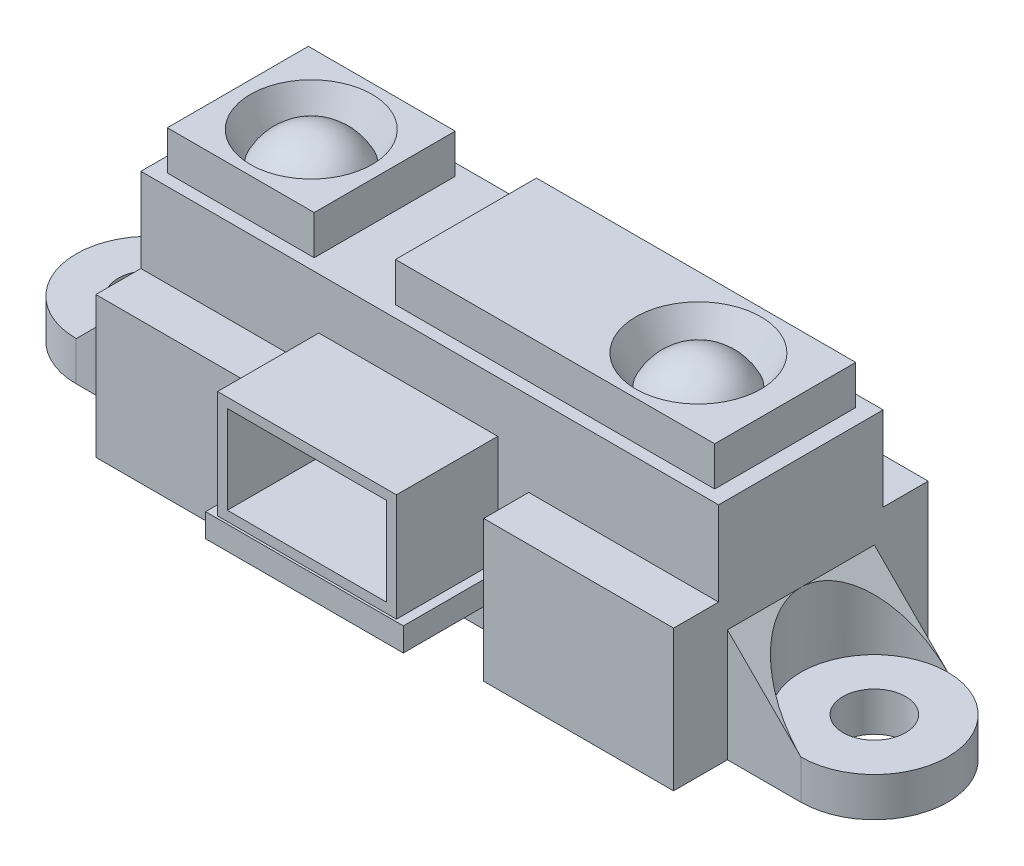
from build123d import *

# Parameters (mm, degrees)
BOSS_EXTRUDE1_DEPTH   = 7.2
SKETCH1_3_R           = 3.75
SKETCH1_3_R_2         = 1.6
BOSS_EXTRUDE2_DEPTH   = 2
BOSS_EXTRUDE2_2_DEPTH = 2
BOSS_EXTRUDE3_DEPTH   = 2
BOSS_EXTRUDE4_DEPTH   = 7.5
SKETCH3_R             = 3.75
CUT_EXTRUDE6_DEPTH    = 12
BOSS_EXTRUDE5_DEPTH   = 7.5
SKETCH5_R             = 3.75
CUT_EXTRUDE7_DEPTH    = 7.5
SKETCH6_W             = 29.5
SKETCH6_H             = 8.4
BOSS_EXTRUDE6_DEPTH   = 4.3
SKETCH7_W             = 7.5
SKETCH7_H             = 7.2
SKETCH7_W_2           = 16.3
BOSS_EXTRUDE7_DEPTH   = 2
SKETCH8_W             = 10.1
SKETCH8_H             = 2.3
CUT_EXTRUDE8_DEPTH    = 12
SKETCH9_W             = 10.1
SKETCH9_H             = 1.2
BOSS_EXTRUDE8_DEPTH   = 6.4
SKETCH11_W            = 9.1347476
SKETCH11_H            = 5.173710516
BOSS_EXTRUDE11_DEPTH  = 5.5
SKETCH12_R            = 3.106234899
CUT_EXTRUDE10_DEPTH   = 1.5
CUT_EXTRUDE10_DRAFT   = -25
SKETCH13_R            = 3.196774454
CUT_EXTRUDE11_DEPTH   = 1.5
CUT_EXTRUDE11_DRAFT   = -29
SKETCH14_W            = 8.1347476
SKETCH14_H            = 4.5
CUT_EXTRUDE12_DEPTH   = 4.5
SCALE1_SCALE          = 0.2


# Read off the part's stored shape, not the designer's step: Dome1, Dome2
with BuildPart() as part:
    # Sketch1 → Boss-Extrude1 (new body)
    with BuildSketch(Plane(origin=(0, 0, 0), x_dir=(1, 0, 0), z_dir=(0, 1, 0))):
        Polygon((14.75, 0), (-14.75, 0), (-14.75, -3.75), (-14.75, -6.5), (14.75, -6.5), (14.75, -3.75), align=None)
        Polygon((-14.75, 3.75), (-14.75, 0), (14.75, 0), (14.75, 3.75), (14.75, 6.5), (-14.75, 6.5), align=None)
    extrude(amount=BOSS_EXTRUDE1_DEPTH)



with BuildPart() as body_2:
    # Sketch1<3> → Boss-Extrude2 (new body)
    with BuildSketch(Plane(origin=(0, 0, 0), x_dir=(1, 0, 0), z_dir=(0, 1, 0))):
        with Locations(Location((-18.5, 0, 0), (0, 0, 270))):
            Circle(SKETCH1_3_R)
        with Locations(Location((-18.5, 0, 0), (0, 0, 270))):
            Circle(SKETCH1_3_R_2, mode=Mode.SUBTRACT)
    extrude(amount=BOSS_EXTRUDE2_DEPTH)


with BuildPart() as body_3:
    # Sketch1<3> → Boss-Extrude2 2 (new body)
    with BuildSketch(Plane(origin=(0, 0, 0), x_dir=(1, 0, 0), z_dir=(0, 1, 0))):
        with Locations(Location((18.5, 0, 0), (0, 0, 270))):
            Circle(SKETCH1_3_R)
        with Locations(Location((18.5, 0, 0), (0, 0, 270))):
            Circle(SKETCH1_3_R_2, mode=Mode.SUBTRACT)
    extrude(amount=BOSS_EXTRUDE2_2_DEPTH)


with BuildPart() as part_1:
    add(part.part)

    add(body_2.part)  # Boss-Extrude3 merges body 2

    add(body_3.part)  # Boss-Extrude3 merges body 3
    # Sketch1<4> → Boss-Extrude3 (add)
    with BuildSketch(Plane(origin=(0, 0, 0), x_dir=(1, 0, 0), z_dir=(0, 1, 0))):
        with BuildLine():
            Line((-14.75, -3.75), (-14.75, 0))
            ThreePointArc((-14.75, 0), (-15.848349571, -2.651650429), (-18.5, -3.75))
            Line((-18.5, -3.75), (-14.75, -3.75))
        make_face()
        with BuildLine():
            Line((-14.75, 0), (-14.75, 3.75))
            Line((-14.75, 3.75), (-18.5, 3.75))
            ThreePointArc((-18.5, 3.75), (-15.848349571, 2.651650429), (-14.75, 0))
        make_face()
        with BuildLine():
            Line((18.5, 3.75), (14.75, 3.75))
            Line((14.75, 3.75), (14.75, 0))
            ThreePointArc((14.75, 0), (15.848349571, 2.651650429), (18.5, 3.75))
        make_face()
        with BuildLine():
            ThreePointArc((18.5, -3.75), (15.848349571, -2.651650429), (14.75, 0))
            Line((14.75, 0), (14.75, -3.75))
            Line((14.75, -3.75), (18.5, -3.75))
        make_face()
    extrude(amount=BOSS_EXTRUDE3_DEPTH)

    # Sketch2 → Boss-Extrude4 (add)
    with BuildSketch(Plane.XY.offset(3.75)):
        Polygon((18.5, 2), (14.75, 2), (14.75, 5.75), align=None)
    extrude(amount=-BOSS_EXTRUDE4_DEPTH)

    # Sketch3 → Cut-Extrude6 (cut)
    with BuildSketch(Plane(origin=(0, 2, 0), x_dir=(1, 0, 0), z_dir=(0, 1, 0))):
        with Locations((18.5, 0)):
            Circle(SKETCH3_R)
    extrude(amount=CUT_EXTRUDE6_DEPTH, mode=Mode.SUBTRACT)

    # Sketch4 → Boss-Extrude5 (add)
    with BuildSketch(Plane.XY.offset(3.75)):
        Polygon((-14.75, 5.75), (-18.5, 2), (-14.75, 2), align=None)
    extrude(amount=-BOSS_EXTRUDE5_DEPTH)

    # Sketch5 → Cut-Extrude7 (cut)
    with BuildSketch(Plane(origin=(0, 2, 0), x_dir=(1, 0, 0), z_dir=(0, 1, 0))):
        with Locations((-18.5, 0)):
            Circle(SKETCH5_R)
    extrude(amount=CUT_EXTRUDE7_DEPTH, mode=Mode.SUBTRACT)

    # Sketch6 → Boss-Extrude6 (add)
    with BuildSketch(Plane(origin=(0, 7.2, 0), x_dir=(1, 0, 0), z_dir=(0, 1, 0))):
        Rectangle(SKETCH6_W, SKETCH6_H)
    extrude(amount=BOSS_EXTRUDE6_DEPTH)

    # Sketch7 → Boss-Extrude7 (add)
    with BuildSketch(Plane(origin=(0, 11.5, 0), x_dir=(1, 0, 0), z_dir=(0, 1, 0))):
        with Locations((-10.25, 0)):
            Rectangle(SKETCH7_W, SKETCH7_H)
        with Locations((5.8, 0)):
            Rectangle(SKETCH7_W_2, SKETCH7_H)
    extrude(amount=BOSS_EXTRUDE7_DEPTH)

    # Sketch8 → Cut-Extrude8 (cut)
    with BuildSketch(Plane(origin=(0, 7.2, 0), x_dir=(1, 0, 0), z_dir=(0, 1, 0))):
        with Locations((0.003829246, -5.35)):
            Rectangle(SKETCH8_W, SKETCH8_H)
    extrude(amount=-CUT_EXTRUDE8_DEPTH, mode=Mode.SUBTRACT)

    # Sketch9 → Boss-Extrude8 (add)
    with BuildSketch(Plane.XY.offset(4.2)):
        with Locations((0.003829246, 3.9)):
            Rectangle(SKETCH9_W, SKETCH9_H)
    extrude(amount=BOSS_EXTRUDE8_DEPTH)

    # Sketch11 → Boss-Extrude11 (add)
    with BuildSketch(Plane(origin=(0, 4.5, 0), x_dir=(1, 0, 0), z_dir=(0, 1, 0))):
        with Locations((0.014014126, -7.894862881)):
            Rectangle(SKETCH11_W, SKETCH11_H)
    extrude(amount=BOSS_EXTRUDE11_DEPTH)


with BuildPart() as cut_extrude10_tool:
    # Sketch12 → Cut-Extrude10 (with draft: the straight prism first)
    with BuildSketch(Plane(origin=(0, 13.5, 0), x_dir=(1, 0, 0), z_dir=(0, 1, 0))):
        with Locations((-10.25, 0)):
            Circle(SKETCH12_R)
    extrude(amount=-CUT_EXTRUDE10_DEPTH)
    # Cut-Extrude10: the draft: its side faces are tilted about the plane it starts from
    cut_extrude10_sides = [cut_extrude10_tool.faces().sort_by_distance(p)[0] for p in [
        (-13.356234899, 12.75, 0),
    ]]
    draft(cut_extrude10_sides, Plane(origin=(0, 13.5, 0), x_dir=(1, 0, 0), z_dir=(0, 1, 0)), CUT_EXTRUDE10_DRAFT)


with BuildPart() as part_2:
    add(part_1.part)

    # Cut-Extrude10: cut by cut_extrude10_tool
    add(cut_extrude10_tool.part, mode=Mode.SUBTRACT)


with BuildPart() as cut_extrude11_tool:
    # Sketch13 → Cut-Extrude11 (with draft: the straight prism first)
    with BuildSketch(Plane(origin=(0, 13.5, 0), x_dir=(1, 0, 0), z_dir=(0, 1, 0))):
        with Locations((9.516994158, 0)):
            Circle(SKETCH13_R)
    extrude(amount=-CUT_EXTRUDE11_DEPTH)
    # Cut-Extrude11: the draft: its side faces are tilted about the plane it starts from
    cut_extrude11_sides = [cut_extrude11_tool.faces().sort_by_distance(p)[0] for p in [
        (6.320219704, 12.75, 0),
    ]]
    draft(cut_extrude11_sides, Plane(origin=(0, 13.5, 0), x_dir=(1, 0, 0), z_dir=(0, 1, 0)), CUT_EXTRUDE11_DRAFT)


with BuildPart() as part_3:
    add(part_2.part)

    # Cut-Extrude11: cut by cut_extrude11_tool
    add(cut_extrude11_tool.part, mode=Mode.SUBTRACT)

    # Dome1 outline → Dome1 (revolve)
    with BuildSketch(Plane(origin=(-10.25, 0, 0), x_dir=(1, 0, 0), z_dir=(0, 0, 1))):
        with BuildLine():
            Line((0, 12), (2.406773413, 11.999999998))
            ThreePointArc((2.406773413, 11.999999998), (1.417970228, 13.094302608), (0, 13.5))
            Line((0, 13.5), (0, 12))
        make_face()
    revolve(axis=Axis((-10.25, 0, 0), (0, 1, 0)))

    # Dome2 outline → Dome2 (revolve)
    with BuildSketch(Plane(origin=(9.516994158, 0, 0), x_dir=(1, 0, 0), z_dir=(0, 0, 1))):
        with BuildLine():
            Line((0, 12), (2.365310878, 11.999999998))
            ThreePointArc((2.365310878, 11.999999998), (1.400419183, 13.093385967), (0, 13.5))
            Line((0, 13.5), (0, 12))
        make_face()
    revolve(axis=Axis((9.516994158, 0, 0), (0, 1, 0)))

    # Sketch14 → Cut-Extrude12 (cut)
    with BuildSketch(Plane.XY.offset(10.481718139)):
        with Locations((0.014014126, 7.25)):
            Rectangle(SKETCH14_W, SKETCH14_H)
    extrude(amount=-CUT_EXTRUDE12_DEPTH, mode=Mode.SUBTRACT)


with BuildPart() as part_4:
    # Scale1: scaled about (0, 0, 0)
    add(part_3.part.scale(SCALE1_SCALE))


solid = part_4.part
